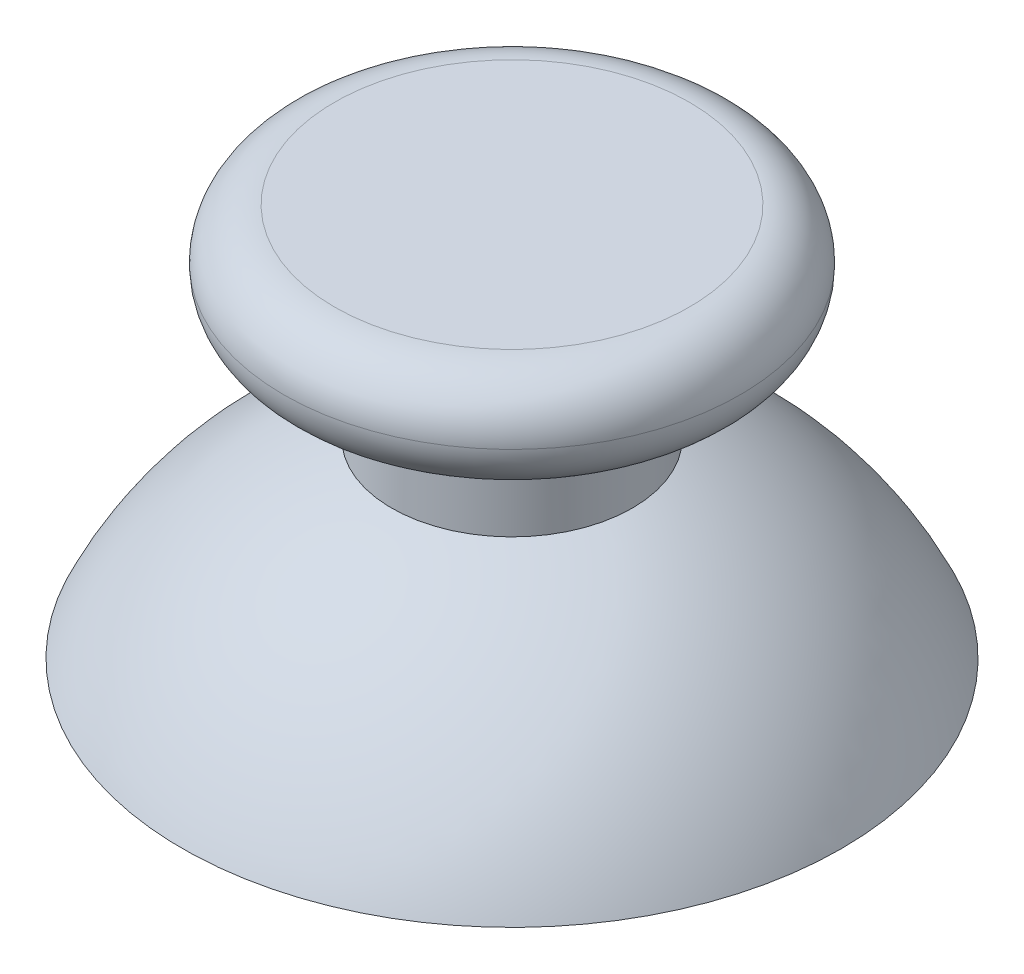
from build123d import *

# Parameters (mm, degrees)
SKETCH1_R           = 4.75
BOSS_EXTRUDE1_DEPTH = 4
SKETCH2_R           = 9
BOSS_EXTRUDE2_DEPTH = 4
FILLET1_R           = 2
SHELL1_T            = -1
SKETCH4_R           = 3.75
BOSS_EXTRUDE4_DEPTH = 2


with BuildPart() as part:
    # Sketch1 → Boss-Extrude1 (new body)
    with BuildSketch(Plane(origin=(0, 0, 0), x_dir=(1, 0, 0), z_dir=(0, 1, 0))):
        with Locations(Location((0, 0, 0), (0, 0, 270))):
            Circle(SKETCH1_R)
    extrude(amount=BOSS_EXTRUDE1_DEPTH)

    # Sketch2 → Boss-Extrude2 (add)
    with BuildSketch(Plane(origin=(0, 4, 0), x_dir=(1, 0, 0), z_dir=(0, 1, 0))):
        with Locations(Location((0, 0, 0), (0, 0, 270))):
            Circle(SKETCH2_R)
    extrude(amount=BOSS_EXTRUDE2_DEPTH)

    # Fillet1
    fillet1_edges = [part.edges().sort_by_distance(p)[0] for p in [
        (0, 4, -9),
        (0, 8, -9),
    ]]
    fillet(fillet1_edges, radius=FILLET1_R - 0.0001)  # a hair under: the kernel refuses the full size

    # Sketch5 → Revolve1 (revolve)
    with BuildSketch(Plane.XY, mode=Mode.PRIVATE) as revolve1_sk:
        with BuildLine():
            Line((0, -7.5), (0, 0.817821063))
            ThreePointArc((0, 0.817821063), (7.716640254, -1.439591085), (13, -7.5))
            Line((13, -7.5), (0, -7.5))
        make_face()
    revolve(revolve1_sk.sketch.rotate(Axis((0, -7.5, 0), (0, 1, 0)), 270), axis=Axis((0, -7.5, 0), (0, 1, 0)))

    # Shell1
    shell1_openings = [part.faces().sort_by_distance(p)[0] for p in [
        (0, -7.5, 0),
    ]]
    offset(amount=SHELL1_T, openings=shell1_openings, kind=Kind.INTERSECTION)

    # Sketch4 → Boss-Extrude4 (add)
    with BuildSketch(Plane(origin=(0, 0, 0), x_dir=(-1, 0, 0), z_dir=(0, -1, 0))):
        with Locations(Location((0, 0, 0), (0, 0, 90))):
            Circle(SKETCH4_R)
    extrude(amount=-BOSS_EXTRUDE4_DEPTH)


solid = part.part
